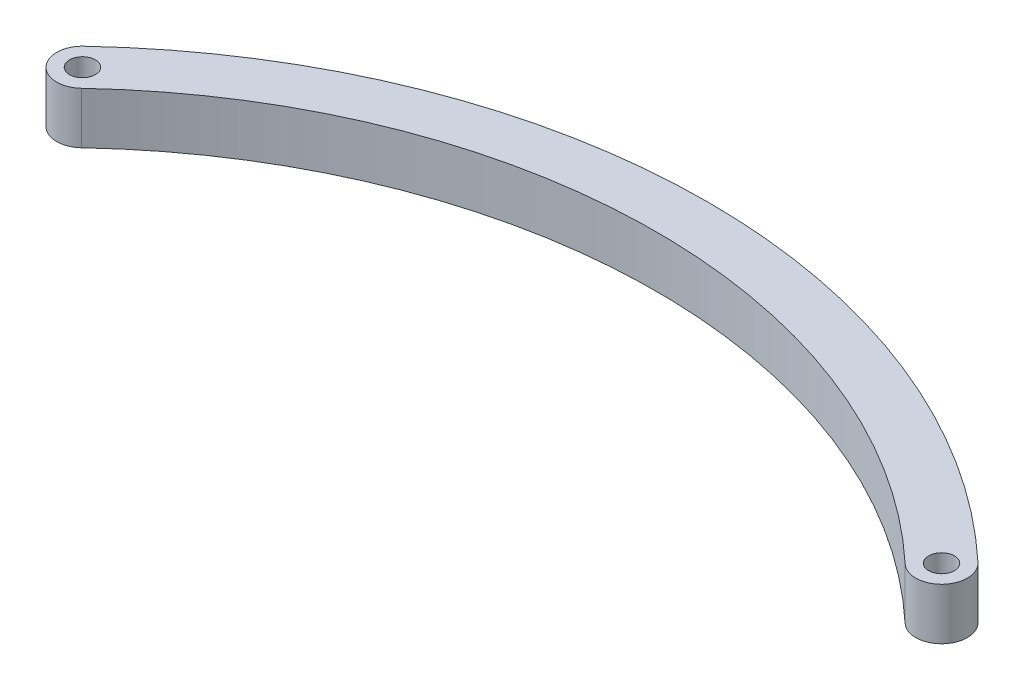
from build123d import *

# Parameters (mm, degrees)
ESQUISSE1_R        = 1.5
BOSS_EXTRU_1_DEPTH = 6


with BuildPart() as part:
    # Esquisse1 → Boss.-Extru.1 (new body)
    with BuildSketch(Plane(origin=(0, 0, 0), x_dir=(1, 0, 0), z_dir=(0, 1, 0))):
        with BuildLine():
            ThreePointArc((-52.054794536, 2.185822365), (-52.185822369, -2.054794533), (-47.945205471, -2.185822372))
            ThreePointArc((-47.945205471, -2.185822372), (-1.4e-08, 16.811655412), (47.94520545, -2.185822352))
            ThreePointArc((47.94520545, -2.185822352), (52.185822338, -2.054794566), (52.054794582, 2.185822323))
            ThreePointArc((52.054794582, 2.185822323), (3.1e-08, 22.811655412), (-52.054794536, 2.185822365))
        make_face()
        with Locations((-50, 0)):
            Circle(ESQUISSE1_R, mode=Mode.SUBTRACT)
        with Locations((50, 0)):
            Circle(ESQUISSE1_R, mode=Mode.SUBTRACT)
    extrude(amount=BOSS_EXTRU_1_DEPTH)


solid = part.part
